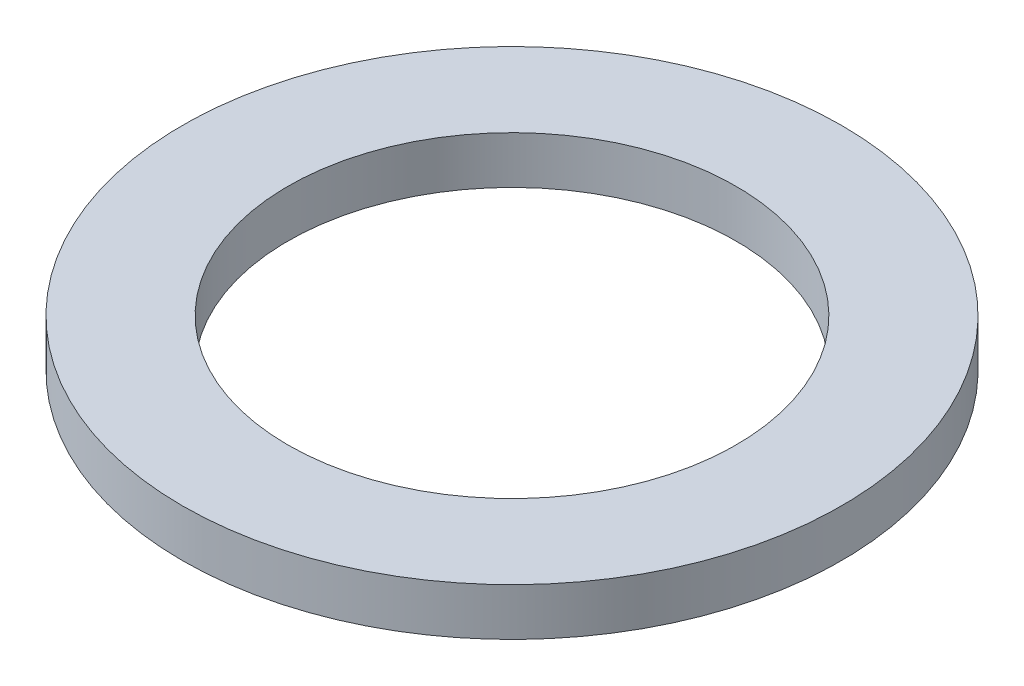
from build123d import *

# Parameters (mm, degrees)
SKETCH1_R           = 62.5
BOSS_EXTRUDE1_DEPTH = 9
SKETCH2_R           = 42.5
CUT_EXTRUDE1_DEPTH  = 89.845371292


with BuildPart() as part:
    # Sketch1 → Boss-Extrude1 (new body)
    with BuildSketch(Plane(origin=(0, 0, 0), x_dir=(1, 0, 0), z_dir=(0, 1, 0))):
        Circle(SKETCH1_R)
    extrude(amount=BOSS_EXTRUDE1_DEPTH)

    # Sketch2 → Cut-Extrude1 (cut, through all)
    with BuildSketch(Plane(origin=(0, 0, 0), x_dir=(1, 0, 0), z_dir=(0, 1, 0))):
        Circle(SKETCH2_R)
    extrude(amount=CUT_EXTRUDE1_DEPTH, mode=Mode.SUBTRACT)


solid = part.part
